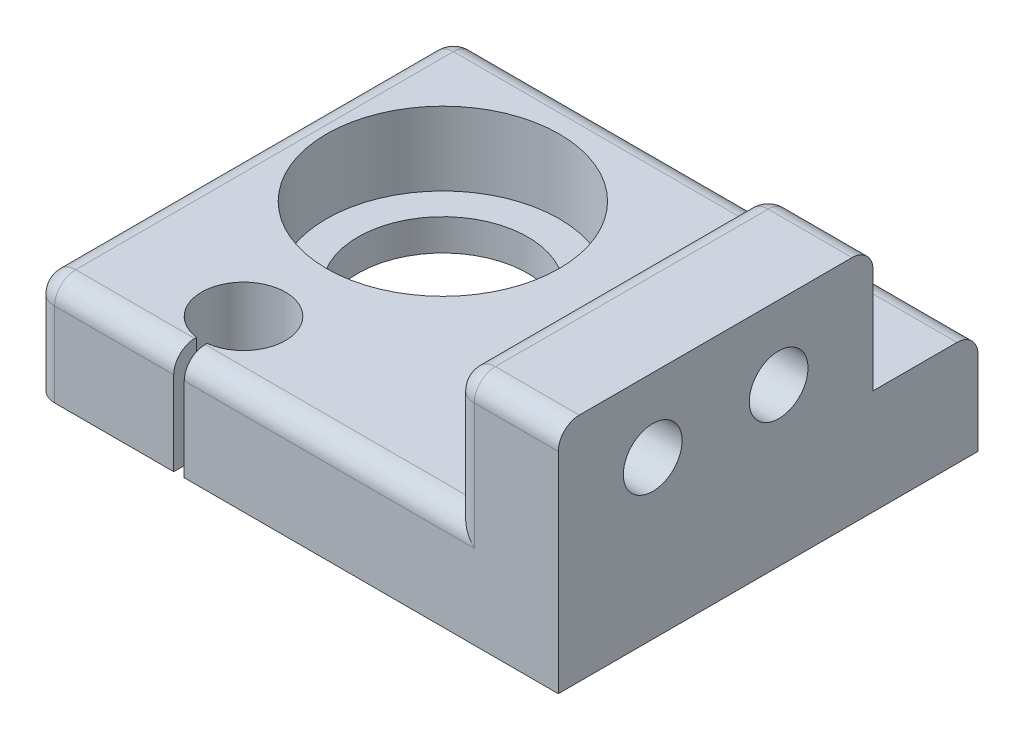
from build123d import *

# Parameters (mm, degrees)
SKETCH1_R           = 8.1
BOSS_EXTRUDE1_DEPTH = 10
SKETCH2_R           = 11.1
CUT_EXTRUDE1_DEPTH  = 7
SKETCH3_W           = 10
SKETCH3_H           = 12
BOSS_EXTRUDE2_DEPTH = 30
SKETCH4_R           = 2.8
CUT_EXTRUDE2_DEPTH  = 61.695963622
SKETCH5_R           = 4.3
CUT_EXTRUDE3_DEPTH  = 6
FILLET1_R           = 2


with BuildPart() as part:
    # Sketch1 → Boss-Extrude1 (new body)
    with BuildSketch(Plane(origin=(0, 0, 0), x_dir=(1, 0, 0), z_dir=(0, 1, 0))):
        with BuildLine():
            Line((50, 0), (0, 0))
            Line((0, 0), (0, -40))
            Line((0, -40), (13.35, -40))
            Line((13.35, -40), (13.35, -37.818626967))
            ThreePointArc((13.35, -37.818626967), (11.204248689, -30.85), (17.85, -33.85))
            ThreePointArc((17.85, -33.85), (16.85, -36.495751311), (14.35, -37.818626967))
            Line((14.35, -37.818626967), (14.35, -40))
            Line((14.35, -40), (50, -40))
            Line((50, -40), (50, 0))
        make_face()
        with Locations((13.85, -14.85)):
            Circle(SKETCH1_R, mode=Mode.SUBTRACT)
    extrude(amount=BOSS_EXTRUDE1_DEPTH)

    # Sketch2 → Cut-Extrude1 (cut)
    with BuildSketch(Plane(origin=(0, 10, 0), x_dir=(1, 0, 0), z_dir=(0, 1, 0))):
        with Locations((13.85, -14.85)):
            Circle(SKETCH2_R)
    extrude(amount=-CUT_EXTRUDE1_DEPTH, mode=Mode.SUBTRACT)

    # Sketch3 → Boss-Extrude2 (add)
    with BuildSketch(Plane(origin=(0, 0, 40), x_dir=(-1, 0, 0), z_dir=(0, 0, -1))):
        with Locations((-45, 16)):
            Rectangle(SKETCH3_W, SKETCH3_H)
    extrude(amount=BOSS_EXTRUDE2_DEPTH)

    # Sketch4 → Cut-Extrude2 (cut, through all)
    with BuildSketch(Plane.ZY.offset(-40)):
        with Locations((19, 15)):
            Circle(SKETCH4_R)
        with Locations((31, 15)):
            Circle(SKETCH4_R)
    extrude(amount=-CUT_EXTRUDE2_DEPTH, mode=Mode.SUBTRACT)

    # Sketch5 → Cut-Extrude3 (cut)
    with BuildSketch(Plane.ZY.offset(-40)):
        with Locations((19, 15)):
            Circle(SKETCH5_R)
        with Locations((31, 15)):
            Circle(SKETCH5_R)
    extrude(amount=-CUT_EXTRUDE3_DEPTH, mode=Mode.SUBTRACT)

    # Fillet1
    fillet1_edges = [part.edges().sort_by_distance(p)[0] for p in [
        (45, 22, 10),
        (40, 16, 10),
        (45, 22, 40),
        (40, 22, 25),
        (40, 16, 40),
        (6.675, 10, 40),
        (27.175, 10, 40),
        (0, 5, 40),
        (0, 10, 20),
        (25, 10, 0),
        (0, 5, 0),
    ]]
    fillet(fillet1_edges, radius=FILLET1_R)


solid = part.part
